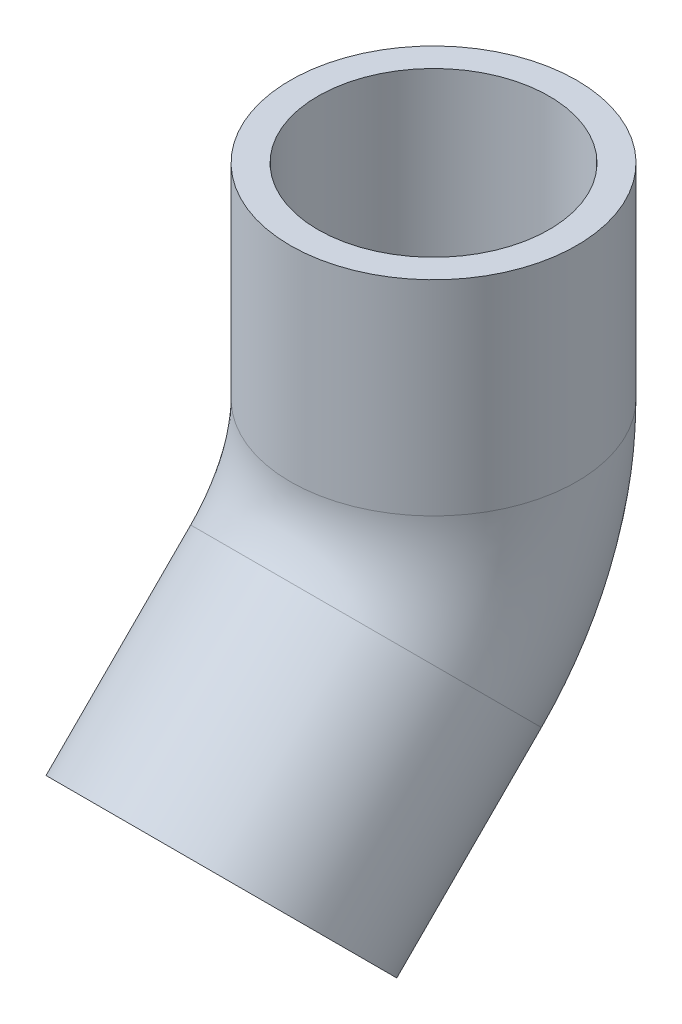
from build123d import *

# Parameters (mm, degrees)
SKETCH3_R          = 16.66875
SKETCH3_R_2        = 10.4648
SKETCH4_R          = 13.462
CUT_EXTRUDE1_DEPTH = 23.8125
SKETCH5_R          = 13.462
CUT_EXTRUDE2_DEPTH = 23.8125


with BuildPart() as part:
    # Sweep1: sweep along a path in Sketch2
    with BuildLine(Plane(origin=(0, 0, 0), x_dir=(0, 0, -1), z_dir=(1, 0, 0))) as sweep1_path:
        Line((-24.695704333, -24.695704333), (-7.857724106, -7.857724106))
        ThreePointArc((-7.857724106, -7.857724106), (-2.04215596, 0.845888695), (0, 11.1125))
        Line((0, 11.1125), (0, 34.925))
    # Sketch3 → Sweep1 (sweep)
    with BuildSketch(Plane(origin=(0, 34.925, 0), x_dir=(1, 0, 0), z_dir=(0, 1, 0))):
        Circle(SKETCH3_R)
        Circle(SKETCH3_R_2, mode=Mode.SUBTRACT)
    sweep(path=sweep1_path.line)

    # Sketch4 → Cut-Extrude1 (cut)
    with BuildSketch(Plane(origin=(0, 34.925, 0), x_dir=(1, 0, 0), z_dir=(0, 1, 0))):
        Circle(SKETCH4_R)
    extrude(amount=-CUT_EXTRUDE1_DEPTH, mode=Mode.SUBTRACT)

    # Sketch5 → Cut-Extrude2 (cut)
    with BuildSketch(Plane(origin=(0, -24.695704333, 24.695704333), x_dir=(1, 0, 0), z_dir=(0, -0.7071067811865559, 0.7071067811865392))):
        Circle(SKETCH5_R)
    extrude(amount=-CUT_EXTRUDE2_DEPTH, mode=Mode.SUBTRACT)


solid = part.part
